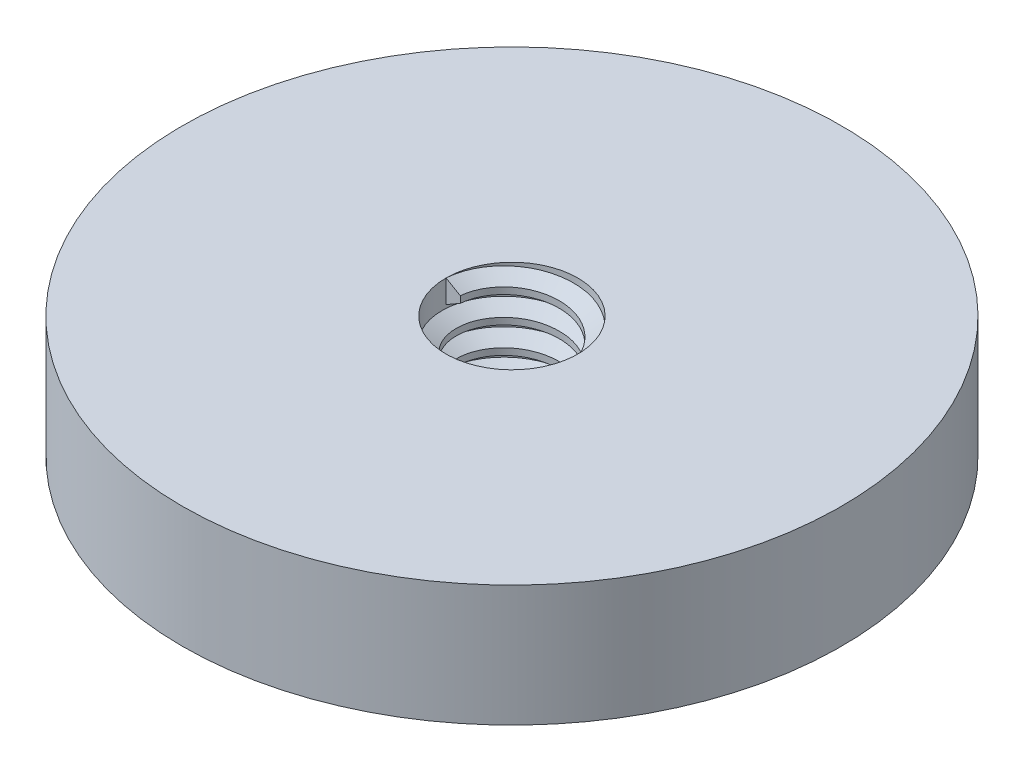
from build123d import *

# Parameters (mm, degrees)
SKETCH1_R           = 15.875
SKETCH1_R_2         = 3.175
BOSS_EXTRUDE1_DEPTH = 5.842
THREAD1_PITCH       = 1.27


with BuildPart() as part:
    # Sketch1 → Boss-Extrude1 (new body)
    with BuildSketch(Plane(origin=(0, 0, 0), x_dir=(1, 0, 0), z_dir=(0, 1, 0))):
        with Locations(Location((0, 0, 0), (0, 0, 270))):
            Circle(SKETCH1_R)
        with Locations(Location((0, 0, 0), (0, 0, 270))):
            Circle(SKETCH1_R_2, mode=Mode.SUBTRACT)
    extrude(amount=BOSS_EXTRUDE1_DEPTH)

    # Thread1: the profile of Thread Profile1 profile screwed along a right-hand helix of 4.6 turns, 8 arcs to a turn; built about Z, then put on its axis
    thread1_z = Axis((0, 0, 0), (0, 0, 1))
    thread1_corners = [(3.1753, 0, -0.000173205), (3.1753, 0, 1.111423202), (2.487592339, 0, 0.714374998), (2.487592339, 0, 0.396874998)]
    with BuildLine(mode=Mode.PRIVATE) as thread1_profile:
        Line(thread1_corners[0], thread1_corners[1])
        Line(thread1_corners[1], thread1_corners[2])
        Line(thread1_corners[2], thread1_corners[3])
        Line(thread1_corners[3], thread1_corners[0])
    thread1_cap = Face(thread1_profile.wire())
    thread1_turn_angles = [0, 22.5, 45, 67.5, 90, 112.5, 135, 157.5, 180, 202.5, 225, 247.5, 270, 292.5, 315, 337.5, 360]
    thread1_turn_weights = [1, 0.9238795325112867, 1, 0.9238795325112867, 1, 0.9238795325112867, 1, 0.9238795325112867, 1, 0.9238795325112867, 1, 0.9238795325112867, 1, 0.9238795325112867, 1, 0.9238795325112867, 1]
    thread1_turn_rails = [Edge.make_bspline([Vector(p[0], p[1], 0).rotate(thread1_z, thread1_turn_angles[k]) / thread1_turn_weights[k] + Vector(0, 0, p[2] + THREAD1_PITCH * thread1_turn_angles[k] / 360) for k in range(17)], [0, 0, 0, 1, 1, 2, 2, 3, 3, 4, 4, 5, 5, 6, 6, 7, 7, 8, 8, 8], 2, thread1_turn_weights) for p in thread1_corners]
    thread1_turn_sides = [Face.make_surface_from_curves(thread1_turn_rails[p[0]], thread1_turn_rails[p[1]]) for p in [(0, 1), (1, 2), (2, 3), (3, 0)]]
    thread1_last_angles = [1440, 1462.5, 1485, 1507.5, 1530, 1552.5, 1575, 1597.5, 1620, 1638, 1656]
    thread1_last_weights = [1, 0.9238795325112867, 1, 0.9238795325112867, 1, 0.9238795325112867, 1, 0.9238795325112867, 1, 0.9510565162951535, 1]
    thread1_last_rails = [Edge.make_bspline([Vector(p[0], p[1], 0).rotate(thread1_z, thread1_last_angles[k]) / thread1_last_weights[k] + Vector(0, 0, p[2] + THREAD1_PITCH * thread1_last_angles[k] / 360) for k in range(11)], [0, 0, 0, 1, 1, 2, 2, 3, 3, 4, 4, 5, 5, 5], 2, thread1_last_weights) for p in thread1_corners]
    thread1_last_sides = [Face.make_surface_from_curves(thread1_last_rails[p[0]], thread1_last_rails[p[1]]) for p in [(0, 1), (1, 2), (2, 3), (3, 0)]]
    thread1 = Plane(origin=(0, 5.842, 0), x_dir=(-1, 0, 0), z_dir=(0, -1, 0)) * Solid(Shell([*[p.moved(Location((0, 0, THREAD1_PITCH * i))) for i in range(4) for p in thread1_turn_sides], *thread1_last_sides, thread1_cap, thread1_cap.rotate(thread1_z, 1656).moved(Location((0, 0, THREAD1_PITCH * 1656 / 360)))]))
    add(thread1)


solid = part.part
